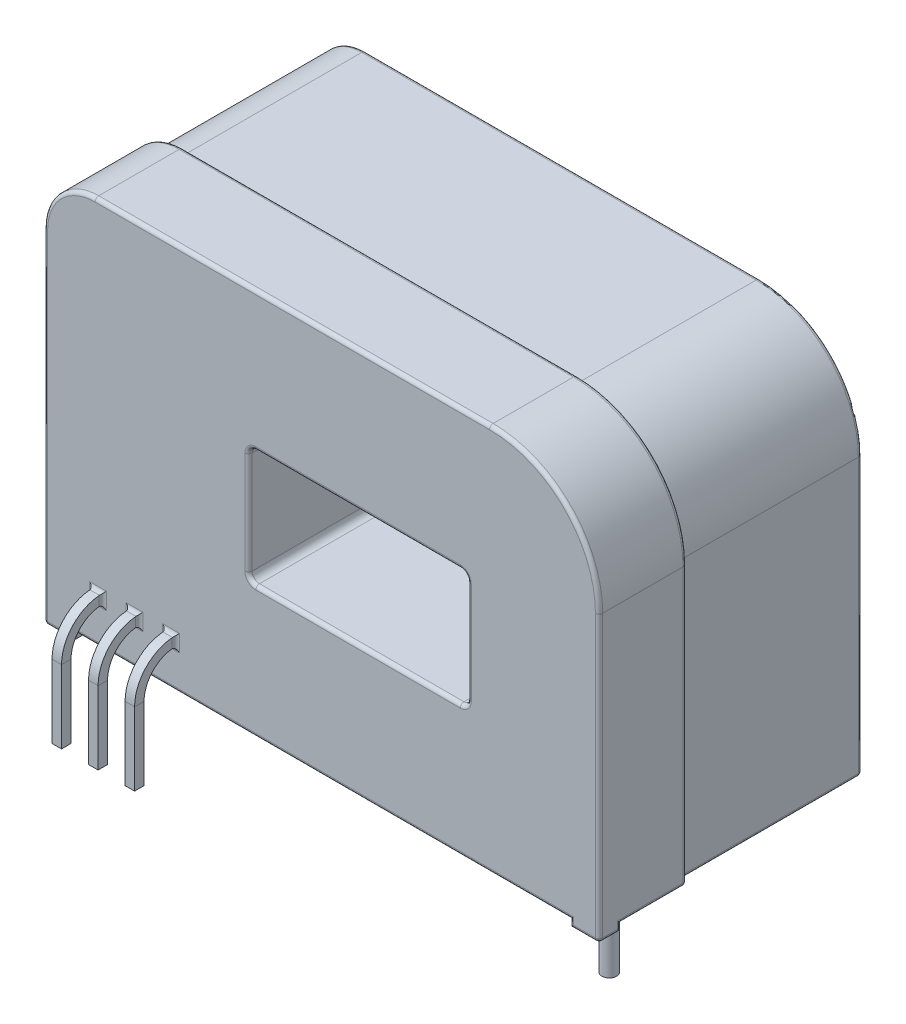
from build123d import *

# Parameters (mm, degrees)
BOSS_EXTRUDE1_DEPTH      = 6
SKETCH1_3_W              = 2
SKETCH1_3_H              = 0.5
BOSS_EXTRUDE2_DEPTH      = 1.5
BOSS_EXTRUDE3_DEPTH      = 12.5
BOSS_EXTRUDE4_START      = -18.5
SKETCH1_4_W              = 2
SKETCH1_4_H              = 0.5
BOSS_EXTRUDE4_DEPTH      = 1.5
BOSS_EXTRUDE5_DEPTH      = 4
BOSS_EXTRUDE5_DEPTH_BACK = 0.5
SKETCH3_R                = 0.5
SKETCH3_W                = 0.65
SKETCH3_H                = 0.65
SKETCH5_W                = 0.65
SKETCH5_H                = 0.65
FILLET1_R                = 0.25


with BuildPart() as part:
    # Sketch1 → Boss-Extrude1 (new body)
    with BuildSketch(Plane.XY):
        with BuildLine():
            Line((0, 23.5), (0, 0.5))
            Line((0, 0.5), (2, 0.5))
            Line((2, 0.5), (18, 0.5))
            Line((18, 0.5), (20, 0.5))
            Line((20, 0.5), (36, 0.5))
            Line((36, 0.5), (38, 0.5))
            Line((38, 0.5), (38, 19.5))
            ThreePointArc((38, 19.5), (35.803300859, 24.803300859), (30.5, 27))
            Line((30.5, 27), (3.5, 27))
            ThreePointArc((3.5, 27), (1.025126266, 25.974873734), (0, 23.5))
        make_face()
        with BuildLine():
            ThreePointArc((14, 17), (14.146446609, 17.353553391), (14.5, 17.5))
            Line((14.5, 17.5), (28.5, 17.5))
            ThreePointArc((28.5, 17.5), (28.853553391, 17.353553391), (29, 17))
            Line((29, 17), (29, 10))
            ThreePointArc((29, 10), (28.853553391, 9.646446609), (28.5, 9.5))
            Line((28.5, 9.5), (14.5, 9.5))
            ThreePointArc((14.5, 9.5), (14.146446609, 9.646446609), (14, 10))
            Line((14, 10), (14, 17))
        make_face(mode=Mode.SUBTRACT)
    extrude(amount=-BOSS_EXTRUDE1_DEPTH)

    # Sketch1<3> → Boss-Extrude2 (add)
    with BuildSketch(Plane.XY):
        with Locations((1, 0.25)):
            Rectangle(SKETCH1_3_W, SKETCH1_3_H)
        with Locations((37, 0.25)):
            Rectangle(SKETCH1_3_W, SKETCH1_3_H)
    extrude(amount=-BOSS_EXTRUDE2_DEPTH)

    # Sketch2 → Boss-Extrude3 (add)
    with BuildSketch(Plane(origin=(0, 0, -6), x_dir=(-1, 0, 0), z_dir=(0, 0, -1))):
        with BuildLine():
            Line((-37.5, 0.5), (-0.5, 0.5))
            Line((-0.5, 0.5), (-0.5, 23.5))
            ThreePointArc((-0.5, 23.5), (-1.378679656, 25.621320344), (-3.5, 26.5))
            Line((-3.5, 26.5), (-30.5, 26.5))
            ThreePointArc((-30.5, 26.5), (-35.449747468, 24.449747468), (-37.5, 19.5))
            Line((-37.5, 19.5), (-37.5, 0.5))
        make_face()
        with BuildLine():
            Line((-14.5, 17.5), (-28.5, 17.5))
            ThreePointArc((-28.5, 17.5), (-28.853553391, 17.353553391), (-29, 17))
            Line((-29, 17), (-29, 10))
            ThreePointArc((-29, 10), (-28.853553391, 9.646446609), (-28.5, 9.5))
            Line((-28.5, 9.5), (-14.5, 9.5))
            ThreePointArc((-14.5, 9.5), (-14.146446609, 9.646446609), (-14, 10))
            Line((-14, 10), (-14, 17))
            ThreePointArc((-14, 17), (-14.146446609, 17.353553391), (-14.5, 17.5))
        make_face(mode=Mode.SUBTRACT)
    extrude(amount=BOSS_EXTRUDE3_DEPTH)

    # Sketch1<4> → Boss-Extrude4 (add)
    with BuildSketch(Plane.XY.offset(BOSS_EXTRUDE4_START)):
        with Locations((19, 0.25)):
            Rectangle(SKETCH1_4_W, SKETCH1_4_H)
    extrude(amount=BOSS_EXTRUDE4_DEPTH)

    # Sketch3 → Boss-Extrude5 (add, two sides: drawn at the far end of the back side and taken through both)
    with BuildSketch(Plane.XZ.offset(-BOSS_EXTRUDE5_DEPTH_BACK)):
        with Locations((7, -14.7)):
            Circle(SKETCH3_R)
        with Locations((36, -2.7)):
            Circle(SKETCH3_R)
        with Locations((6.2, 2.5)):
            Rectangle(SKETCH3_W, SKETCH3_H)
        with Locations((3.7, 2.5)):
            Rectangle(SKETCH3_W, SKETCH3_H)
        with Locations((8.7, 2.5)):
            Rectangle(SKETCH3_W, SKETCH3_H)
    extrude(amount=BOSS_EXTRUDE5_DEPTH + BOSS_EXTRUDE5_DEPTH_BACK)


with BuildPart() as boss_extrude5_piece_1:
    # of the separate pieces the step leaves, piece 1, a body of its own (boss_extrude5_pieces)
    add(part.part.solids().sort_by_distance((0, 23.5, 0))[0])



with BuildPart() as boss_extrude5_piece_2:
    # of the separate pieces the step leaves, piece 2, a body of its own (boss_extrude5_pieces)
    add(part.part.solids().sort_by_distance((8.375, -4, 2.825))[0])


with BuildPart() as boss_extrude5_piece_3:
    # of the separate pieces the step leaves, piece 3, a body of its own (boss_extrude5_pieces)
    add(part.part.solids().sort_by_distance((3.375, -4, 2.825))[0])


with BuildPart() as boss_extrude5_piece_4:
    # of the separate pieces the step leaves, piece 4, a body of its own (boss_extrude5_pieces)
    add(part.part.solids().sort_by_distance((5.875, -4, 2.825))[0])


with BuildPart() as boss_extrude5_piece_1_1:
    add(boss_extrude5_piece_1.part)

    add(boss_extrude5_piece_2.part)  # Sweep2 merges Boss-Extrude5 piece 2

    add(boss_extrude5_piece_3.part)  # Sweep2 merges Boss-Extrude5 piece 3

    add(boss_extrude5_piece_4.part)  # Sweep2 merges Boss-Extrude5 piece 4
    # Sweep2: sweep along a path in Sketch4
    with BuildLine(Plane.ZY.offset(-3.375)) as sweep2_path:
        Line((2.175, 0), (2.175, 1))
        ThreePointArc((2.175, 1), (1.537957249, 2.537957249), (0, 3.175))
    # Sketch5 → Sweep2 (sweep)
    with BuildSketch(Plane.XZ):
        with Locations((8.7, 2.5)):
            Rectangle(SKETCH5_W, SKETCH5_H)
        with Locations((6.2, 2.5)):
            Rectangle(SKETCH5_W, SKETCH5_H)
        with Locations((3.7, 2.5)):
            Rectangle(SKETCH5_W, SKETCH5_H)
    sweep(path=sweep2_path.line)

    # Fillet1
    fillet1_edges = [boss_extrude5_piece_1_1.edges().sort_by_distance(p)[0] for p in [
        (1.378679656, 25.621320344, -6),
        (17, 26.5, -6),
        (37.5, 10, -6),
        (0.5, 12, -6),
        (3.7, 3.175, 0),
        (4.025, 3.5, 0),
        (3.7, 3.825, 0),
        (3.375, 3.5, 0),
        (5.875, 3.5, 0),
        (6.2, 3.175, 0),
        (6.525, 3.5, 0),
        (6.2, 3.825, 0),
        (8.7, 3.825, 0),
        (8.375, 3.5, 0),
        (8.7, 3.175, 0),
        (9.025, 3.5, 0),
        (35.449747468, 24.449747468, -6),
    ]]
    fillet(fillet1_edges, radius=FILLET1_R)
    fillet1_2_edges = [boss_extrude5_piece_1_1.edges().sort_by_distance(p)[0] for p in [
        (1.025126266, 25.974873734, -6),
        (17, 27, -6),
        (35.803300859, 24.803300859, -6),
        (37.5, 0.5, -12.375),
        (0.5, 0.5, -12.375),
        (0, 0, -0.75),
        (0, 0.25, -1.5),
        (0, 0.5, -3.75),
        (0, 12, -6),
        (38, 10, -6),
        (38, 0.5, -3.75),
        (38, 0.25, -1.5),
        (38, 0, -0.75),
        (14.146446609, 17.353553391, 0),
        (14.146446609, 17.353553391, -18.5),
        (14, 13.5, 0),
        (14, 13.5, -18.5),
        (14.146446609, 9.646446609, 0),
        (14.146446609, 9.646446609, -18.5),
        (21.5, 9.5, 0),
        (21.5, 9.5, -18.5),
        (28.853553391, 9.646446609, 0),
        (28.853553391, 9.646446609, -18.5),
        (29, 13.5, 0),
        (29, 13.5, -18.5),
        (28.853553391, 17.353553391, 0),
        (28.853553391, 17.353553391, -18.5),
        (21.5, 17.5, 0),
        (21.5, 17.5, -18.5),
        (38, 9.75, 0),
        (37, 0, 0),
        (36, 0.25, 0),
        (19, 0.5, 0),
        (2, 0.25, 0),
        (1, 0, 0),
        (0, 11.75, 0),
        (1.025126266, 25.974873734, 0),
        (17, 27, 0),
        (35.803300859, 24.803300859, 0),
        (0.5, 12, -18.5),
        (9.25, 0.5, -18.5),
        (18, 0.25, -18.5),
        (19, 0, -18.5),
        (20, 0.25, -18.5),
        (28.75, 0.5, -18.5),
        (37.5, 10, -18.5),
        (35.449747468, 24.449747468, -18.5),
        (17, 26.5, -18.5),
        (1.378679656, 25.621320344, -18.5),
        (0.426776695, 0.5, -6.073223305),
        (37.573223305, 0.5, -6.073223305),
    ]]
    fillet(fillet1_2_edges, radius=FILLET1_R - 0.0001)  # a hair under: the kernel refuses the full size


solid = boss_extrude5_piece_1_1.part
